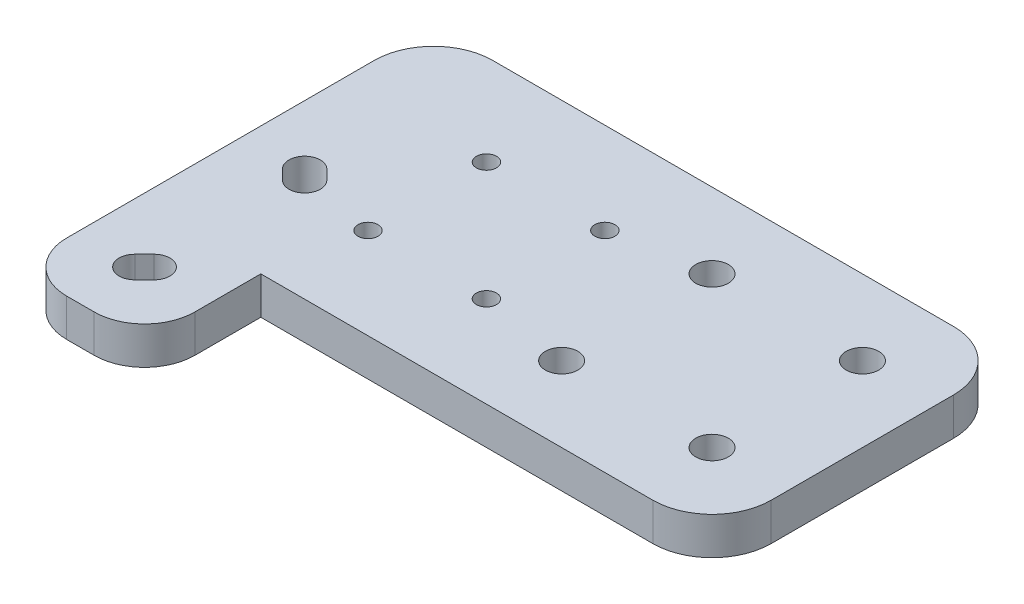
from build123d import *

# Parameters (mm, degrees)
BOSS_EXTRUDE1_DEPTH  = 6.35
FILLET1_R            = 8.5
FILLET2_R            = 10
M5_CLEARANCE_HOLE1_D = 5.5
M3_CLEARANCE_HOLE1_D = 3.4
CUT_EXTRUDE1_DEPTH   = 76.085229573


with BuildPart() as part:
    # Sketch1 → Boss-Extrude1 (new body)
    with BuildSketch(Plane(origin=(0, 0, 0), x_dir=(1, 0, 0), z_dir=(0, 1, 0))):
        Polygon((38.1, -25.4), (-38.1, -25.4), (-38.1, -45.04), (-59.74, -45.04), (-59.74, 25.4), (-38.1, 25.4), (38.1, 25.4), align=None)
    extrude(amount=BOSS_EXTRUDE1_DEPTH)

    # Fillet1
    fillet1_edges = [part.edges().sort_by_distance(p)[0] for p in [
        (-59.74, 3.175, 45.04),
        (-38.1, 3.175, 45.04),
    ]]
    fillet(fillet1_edges, radius=FILLET1_R)

    # Fillet2
    fillet2_edges = [part.edges().sort_by_distance(p)[0] for p in [
        (38.1, 3.175, -25.4),
        (38.1, 3.175, 25.4),
        (-59.74, 3.175, -25.4),
    ]]
    fillet(fillet2_edges, radius=FILLET2_R)

    # M5 Clearance Hole1 (through all)
    with Locations(Plane(origin=(0, 6.35, 0), x_dir=(-1, 0, 0), z_dir=(0, 1, 0))):
        with Locations((0, 12.7), (-25.4, 12.7), (-25.4, -12.7), (0, -12.7)):
            Hole(M5_CLEARANCE_HOLE1_D / 2)

    # M3 Clearance Hole1 (through all)
    with Locations(Plane(origin=(0, 6.35, 0), x_dir=(-1, 0, 0), z_dir=(0, 1, 0))):
        with Locations((15.4, 10), (15.4, -10), (35.4, -10), (35.4, 10)):
            Hole(M3_CLEARANCE_HOLE1_D / 2)

    # Sketch8 → Cut-Extrude1 (cut, through all)
    with BuildSketch(Plane(origin=(0, 6.35, 0), x_dir=(1, 0, 0), z_dir=(0, 1, 0))):
        with BuildLine():
            Line((-51.61383297, -8.23383297), (-49.97383297, -9.87383297))
            ThreePointArc((-49.97383297, -9.87383297), (-46.22616703, -9.87383297), (-46.22616703, -6.12616703))
            Line((-46.22616703, -6.12616703), (-47.86616703, -4.48616703))
            ThreePointArc((-47.86616703, -4.48616703), (-51.61383297, -4.48616703), (-51.61383297, -8.23383297))
        make_face()
        with BuildLine():
            Line((-47.86616703, -36.91383297), (-46.22616703, -35.27383297))
            ThreePointArc((-46.22616703, -35.27383297), (-46.22616703, -31.52616703), (-49.97383297, -31.52616703))
            Line((-49.97383297, -31.52616703), (-51.61383297, -33.16616703))
            ThreePointArc((-51.61383297, -33.16616703), (-51.61383297, -36.91383297), (-47.86616703, -36.91383297))
        make_face()
    extrude(amount=-CUT_EXTRUDE1_DEPTH, mode=Mode.SUBTRACT)


solid = part.part
